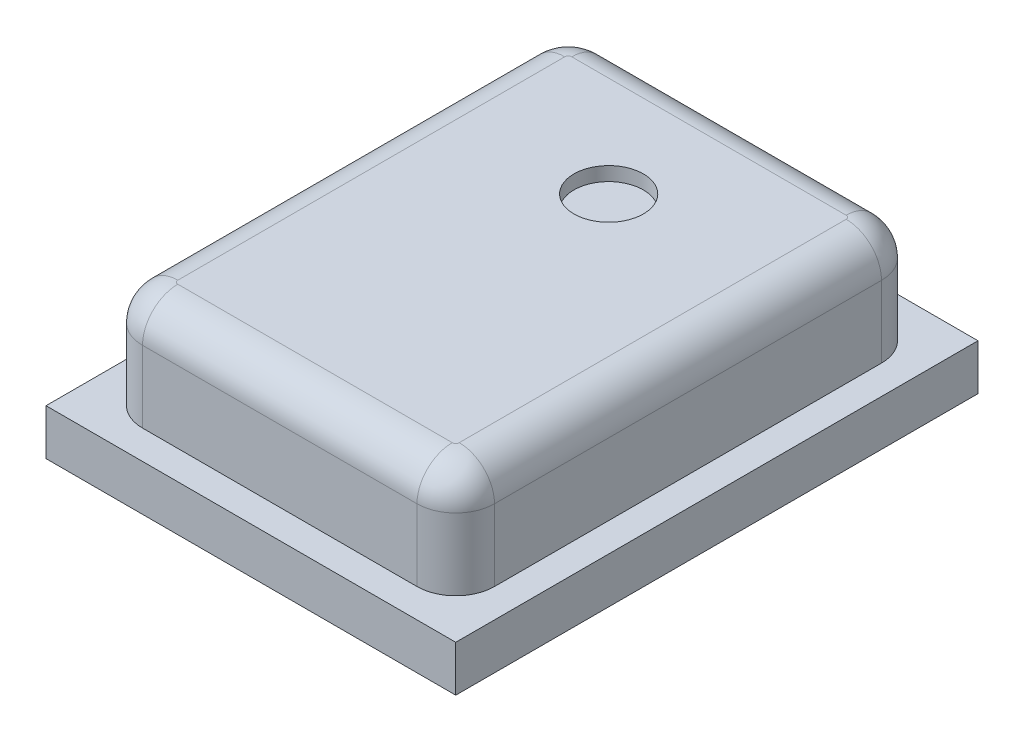
from build123d import *

# Parameters (mm, degrees)
SKETCH1_W           = 2.95
SKETCH1_H           = 3.76
BOSS_EXTRUDE1_DEPTH = 0.33
SKETCH2_W           = 2.534
SKETCH2_H           = 3.344
BOSS_EXTRUDE2_DEPTH = 0.77
FILLET1_R           = 0.254
FILLET2_R           = 0.279
SKETCH3_R           = 0.25
CUT_EXTRUDE1_DEPTH  = 0.1


with BuildPart() as part:
    # Sketch1 → Boss-Extrude1 (new body)
    with BuildSketch(Plane(origin=(0, 0, 0), x_dir=(1, 0, 0), z_dir=(0, 1, 0))):
        Rectangle(SKETCH1_W, SKETCH1_H)
    extrude(amount=BOSS_EXTRUDE1_DEPTH)

    # Sketch2 → Boss-Extrude2 (add)
    with BuildSketch(Plane(origin=(0, 0.33, 0), x_dir=(1, 0, 0), z_dir=(0, 1, 0))):
        Rectangle(SKETCH2_W, SKETCH2_H)
    extrude(amount=BOSS_EXTRUDE2_DEPTH)

    # Fillet1
    fillet1_edges = [part.edges().sort_by_distance(p)[0] for p in [
        (1.267, 1.1, 0),
        (0, 1.1, -1.672),
        (-1.267, 1.1, 0),
        (0, 1.1, 1.672),
    ]]
    fillet(fillet1_edges, radius=FILLET1_R)

    # Fillet2
    # the kernel refuses this fillet: 0.279 mm, written as the material it takes off along each edge
    with BuildSketch(Plane(origin=(-0.988, 1.1, -1.393), x_dir=(0, 0, -1), z_dir=(1, 0, 0))) as fillet2_piece_1:
        with BuildLine():
            CenterArc((0.025, -0.254), 0.254, 0, 90)
            Line((0.279, -0.254), (0.279, 0))
            Line((0.279, 0), (0.025, 0))
        make_face()
    revolve(axis=Axis((-0.988, 1.1, -1.393), (0, 1, 0)), revolution_arc=90, mode=Mode.SUBTRACT)
    with BuildSketch(Plane(origin=(0.988, 1.1, -1.393), x_dir=(1, 0, 0), z_dir=(0, 0, 1))) as fillet2_piece_2:
        with BuildLine():
            CenterArc((0.025, -0.254), 0.254, 0, 90)
            Line((0.279, -0.254), (0.279, 0))
            Line((0.279, 0), (0.025, 0))
        make_face()
    revolve(axis=Axis((0.988, 1.1, -1.393), (0, 1, 0)), revolution_arc=90, mode=Mode.SUBTRACT)
    with BuildSketch(Plane(origin=(-0.988, 1.1, 1.393), x_dir=(-1, 0, 0), z_dir=(0, 0, -1))) as fillet2_piece_3:
        with BuildLine():
            CenterArc((0.025, -0.254), 0.254, 0, 90)
            Line((0.279, -0.254), (0.279, 0))
            Line((0.279, 0), (0.025, 0))
        make_face()
    revolve(axis=Axis((-0.988, 1.1, 1.393), (0, 1, 0)), revolution_arc=90, mode=Mode.SUBTRACT)
    with BuildSketch(Plane(origin=(0.988, 1.1, 1.393), x_dir=(0, 0, 1), z_dir=(-1, 0, 0))) as fillet2_piece_4:
        with BuildLine():
            CenterArc((0.025, -0.254), 0.254, 0, 90)
            Line((0.279, -0.254), (0.279, 0))
            Line((0.279, 0), (0.025, 0))
        make_face()
    revolve(axis=Axis((0.988, 1.1, 1.393), (0, 1, 0)), revolution_arc=90, mode=Mode.SUBTRACT)
    with BuildSketch(Plane(origin=(1.267, 0.33, 1.672), x_dir=(-1, 0, 0), z_dir=(0, 1, 0)), Plane(origin=(-1.267, 0.33, 1.672), x_dir=(0, 0, -1), z_dir=(0, 1, 0))) as fillet2_piece_5:
        with BuildLine():
            CenterArc((FILLET2_R, -FILLET2_R), FILLET2_R, 90, 90)
            Line((0, -FILLET2_R), (0, 0))
            Line((0, 0), (FILLET2_R, 0))
        make_face()
    extrude(amount=0.77, mode=Mode.SUBTRACT)
    with BuildSketch(Plane(origin=(-1.267, 0.33, -1.672), x_dir=(0, 0, 1), z_dir=(0, 1, 0)), Plane(origin=(1.267, 0.33, -1.672), x_dir=(-1, 0, 0), z_dir=(0, 1, 0))) as fillet2_piece_6:
        with BuildLine():
            CenterArc((FILLET2_R, FILLET2_R), FILLET2_R, 180, 90)
            Line((0, FILLET2_R), (0, 0))
            Line((0, 0), (FILLET2_R, 0))
        make_face()
    extrude(amount=0.77, mode=Mode.SUBTRACT)

    # Sketch3 → Cut-Extrude1 (cut)
    with BuildSketch(Plane(origin=(0, 1.1, 0), x_dir=(1, 0, 0), z_dir=(0, 1, 0))):
        with Locations(Location((0, 0.696, 0), (0, 0, 270))):
            Circle(SKETCH3_R)
    extrude(amount=-CUT_EXTRUDE1_DEPTH, mode=Mode.SUBTRACT)


solid = part.part
